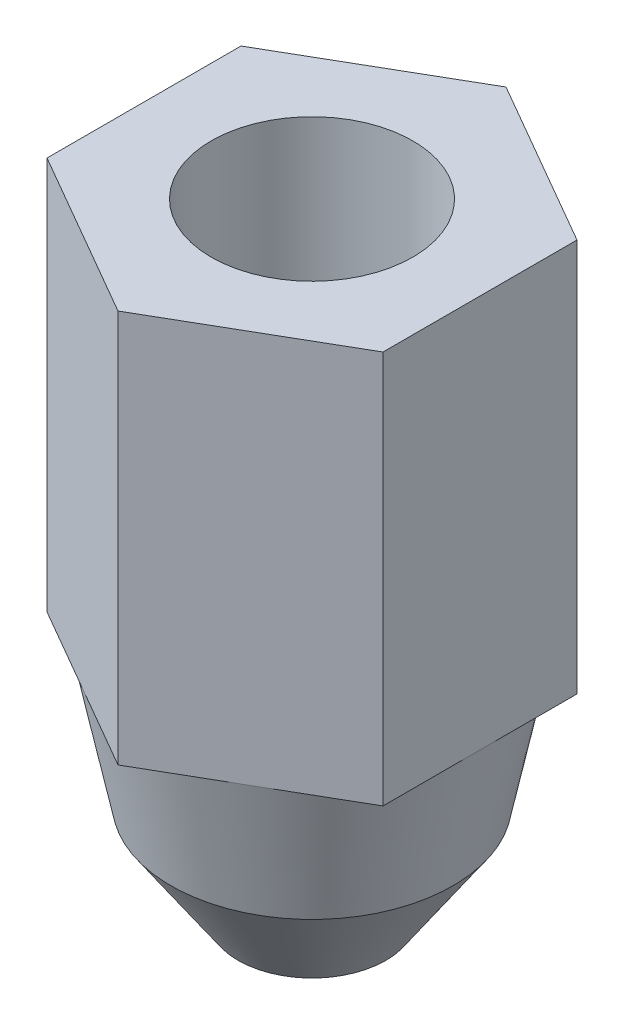
from build123d import *

# Parameters (mm, degrees)
BOSS_EXTRUDE1_DEPTH = 11.7
SKETCH3_R           = 3
CUT_EXTRUDE1_DEPTH  = 12


with BuildPart() as part:
    # Sketch1 → Boss-Extrude1 (new body)
    with BuildSketch(Plane(origin=(0, 0, 0), x_dir=(1, 0, 0), z_dir=(0, 1, 0))):
        Polygon((5, -2.886751346), (0, -5.773502692), (-5, -2.886751346), (-5, 2.886751346), (0, 5.773502692), (5, 2.886751346), align=None)
    extrude(amount=-BOSS_EXTRUDE1_DEPTH)

    # Sketch2 → Revolve1 (revolve)
    with BuildSketch(Plane.XY):
        Polygon((0, -11.7), (5, -11.7), (4.2, -15.6), (2.2, -18.525), (0, -19.5), align=None)
    revolve(axis=Axis((0, -10, 0), (0, 1, 0)))

    # Sketch3 → Cut-Extrude1 (cut)
    with BuildSketch(Plane(origin=(0, 0, 0), x_dir=(1, 0, 0), z_dir=(0, 1, 0))):
        Circle(SKETCH3_R)
    extrude(amount=-CUT_EXTRUDE1_DEPTH, mode=Mode.SUBTRACT)


solid = part.part
